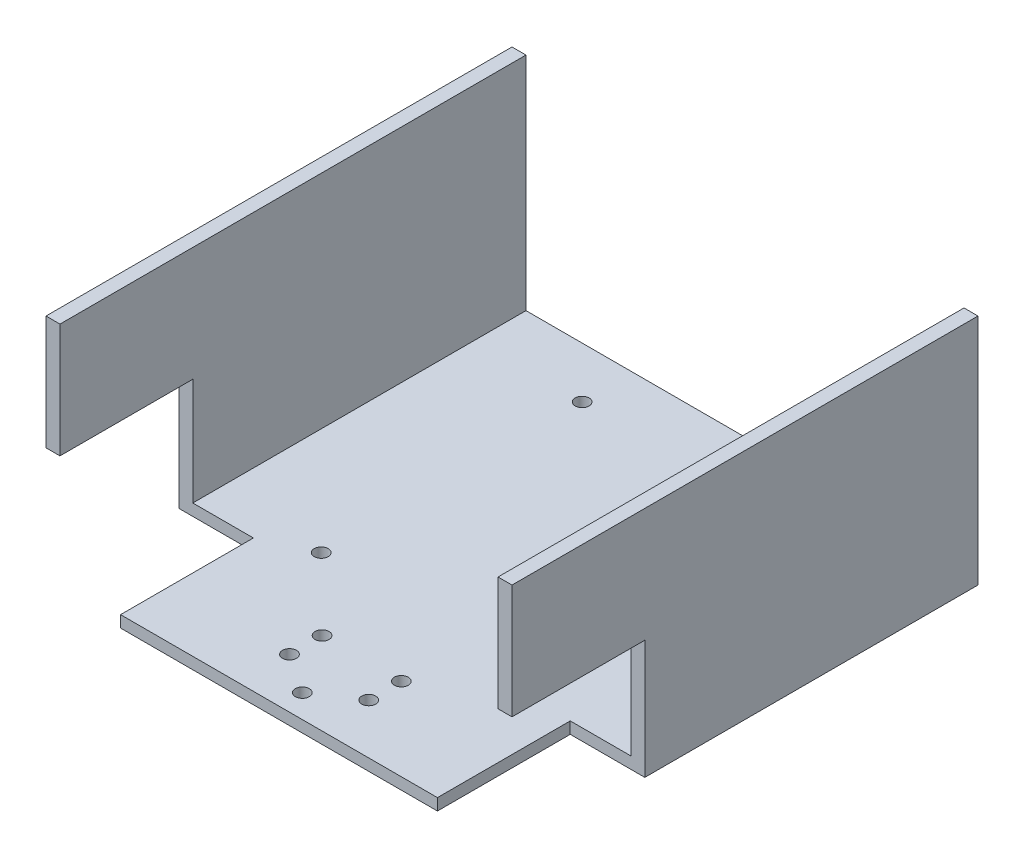
from build123d import *

# Parameters (mm, degrees)
SALIENTE_EXTRUIR1_DEPTH = 100
CROQUIS2_W              = 13
CROQUIS2_H              = 28.5
CORTAR_EXTRUIR2_DEPTH   = 10
CROQUIS3_R              = 1.5
CORTAR_EXTRUIR3_DEPTH   = 5
CROQUIS4_R              = 1.5
CORTAR_EXTRUIR4_DEPTH   = 10
CROQUIS5_R              = 1.5
CORTAR_EXTRUIR6_DEPTH   = 10
CROQUIS6_W              = 28.5
CROQUIS6_H              = 23
CORTAR_EXTRUIR8_DEPTH   = 151
CROQUIS7_W              = 3
CROQUIS7_H              = 2.5
CORTAR_EXTRUIR9_DEPTH   = 28.5


with BuildPart() as part:
    # Croquis1 → Saliente-Extruir1 (new body)
    with BuildSketch(Plane.XY):
        Polygon((50, 0), (-50, 0), (-50, 50), (-47, 50), (-47, 2.5), (47, 2.5), (47, 50), (50, 50), align=None)
    extrude(amount=-SALIENTE_EXTRUIR1_DEPTH)

    # Croquis2 → Cortar-Extruir2 (cut)
    with BuildSketch(Plane(origin=(0, 2.5, 0), x_dir=(1, 0, 0), z_dir=(0, 1, 0))):
        with Locations((-40.5, 14.25)):
            Rectangle(CROQUIS2_W, CROQUIS2_H)
        with Locations((40.5, 14.25)):
            Rectangle(CROQUIS2_W, CROQUIS2_H)
    extrude(amount=-CORTAR_EXTRUIR2_DEPTH, mode=Mode.SUBTRACT)

    # Croquis3 → Cortar-Extruir3 (cut)
    with BuildSketch(Plane(origin=(0, 2.5, 0), x_dir=(1, 0, 0), z_dir=(0, 1, 0))):
        with Locations((0, 5)):
            Circle(CROQUIS3_R)
    extrude(amount=-CORTAR_EXTRUIR3_DEPTH, mode=Mode.SUBTRACT)

    # Croquis4 → Cortar-Extruir4 (cut)
    with BuildSketch(Plane(origin=(0, 2.5, 0), x_dir=(1, 0, 0), z_dir=(0, 1, 0))):
        with Locations((-8.5, 17.75)):
            Circle(CROQUIS4_R)
        with Locations((-8.5, 10.75)):
            Circle(CROQUIS4_R)
        with Locations((8.5, 10.75)):
            Circle(CROQUIS4_R)
        with Locations((8.5, 17.75)):
            Circle(CROQUIS4_R)
    extrude(amount=-CORTAR_EXTRUIR4_DEPTH, mode=Mode.SUBTRACT)

    # Croquis5 → Cortar-Extruir6 (cut)
    with BuildSketch(Plane(origin=(0, 2.5, 0), x_dir=(1, 0, 0), z_dir=(0, 1, 0))):
        with Locations((-24, 89.05)):
            Circle(CROQUIS5_R)
        with Locations((-24, 33.05)):
            Circle(CROQUIS5_R)
        with Locations((24, 33.05)):
            Circle(CROQUIS5_R)
        with Locations((24, 89.05)):
            Circle(CROQUIS5_R)
    extrude(amount=-CORTAR_EXTRUIR6_DEPTH, mode=Mode.SUBTRACT)

    # Croquis6 → Cortar-Extruir8 (cut, through all)
    with BuildSketch(Plane.ZY.offset(50)):
        with Locations((-14.25, 14)):
            Rectangle(CROQUIS6_W, CROQUIS6_H)
    extrude(amount=-CORTAR_EXTRUIR8_DEPTH, mode=Mode.SUBTRACT)

    # Croquis7 → Cortar-Extruir9 (cut)
    with BuildSketch(Plane.XY):
        with Locations((-48.5, 1.25)):
            Rectangle(CROQUIS7_W, CROQUIS7_H)
        with Locations((48.5, 1.25)):
            Rectangle(CROQUIS7_W, CROQUIS7_H)
    extrude(amount=-CORTAR_EXTRUIR9_DEPTH, mode=Mode.SUBTRACT)


solid = part.part
